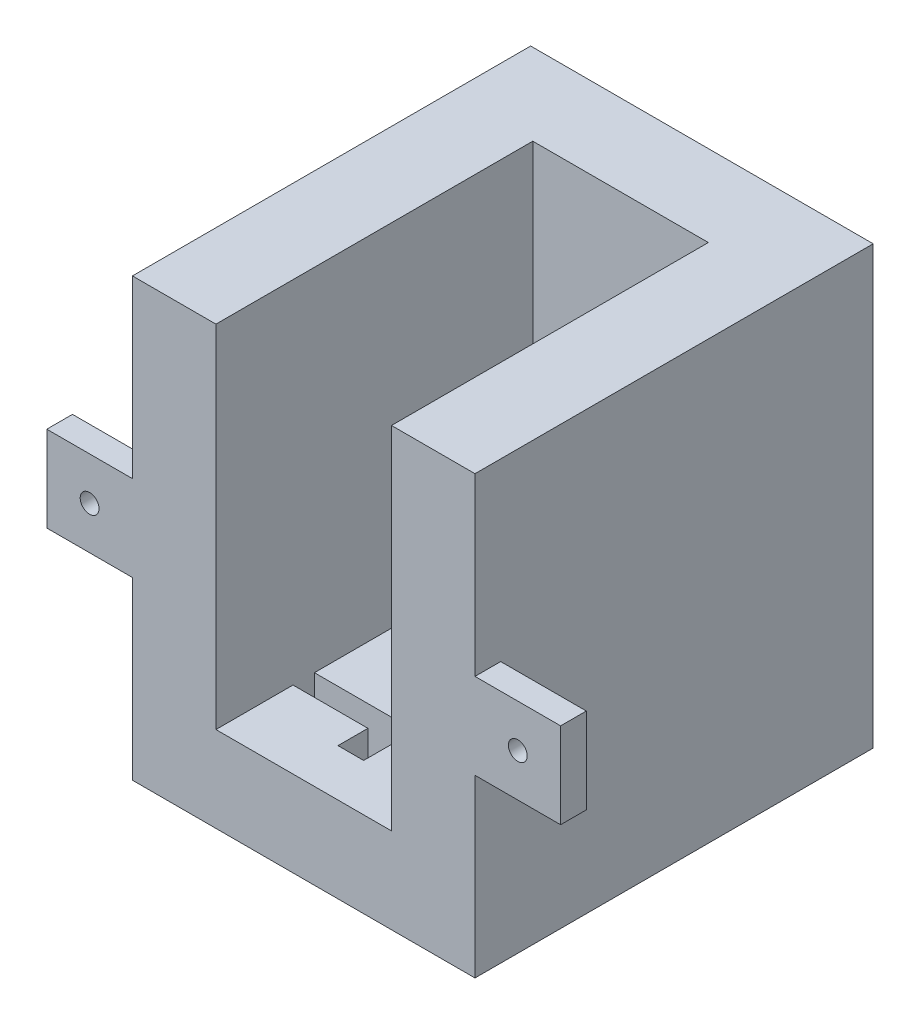
from build123d import *

# Parameters (mm, degrees)
SKETCH1_W           = 40
SKETCH1_H           = 46.5
BOSS_EXTRUDE1_DEPTH = 51
SKETCH2_W           = 20.5
SKETCH2_H           = 37
CUT_EXTRUDE1_DEPTH  = 41
CUT_EXTRUDE2_DEPTH  = 8.5
SKETCH4_W           = 3
SKETCH4_H           = 10
BOSS_EXTRUDE2_DEPTH = 10
SKETCH5_R           = 1.1
CUT_EXTRUDE3_DEPTH  = 10
SKETCH6_W           = 3
SKETCH6_H           = 10
BOSS_EXTRUDE3_DEPTH = 10
SKETCH7_R           = 1.1
CUT_EXTRUDE4_DEPTH  = 10


with BuildPart() as part:
    # Sketch1 → Boss-Extrude1 (new body)
    with BuildSketch(Plane(origin=(0, 0, 0), x_dir=(1, 0, 0), z_dir=(0, 1, 0))):
        Rectangle(SKETCH1_W, SKETCH1_H)
    extrude(amount=BOSS_EXTRUDE1_DEPTH)

    # Sketch2 → Cut-Extrude1 (cut)
    with BuildSketch(Plane(origin=(0, 51, 0), x_dir=(1, 0, 0), z_dir=(0, 1, 0))):
        with Locations((0, -4.75)):
            Rectangle(SKETCH2_W, SKETCH2_H)
    extrude(amount=-CUT_EXTRUDE1_DEPTH, mode=Mode.SUBTRACT)

    # Sketch3 → Cut-Extrude2 (cut)
    with BuildSketch(Plane(origin=(0, 10, 0), x_dir=(1, 0, 0), z_dir=(0, 1, 0))):
        Polygon((-10.25, -11.75), (10.25, -11.75), (10.25, -14.25), (1.5, -14.25), (1.5, -17.75), (-1.5, -17.75), (-1.5, -14.25), (-10.25, -14.25), align=None)
    extrude(amount=-CUT_EXTRUDE2_DEPTH, mode=Mode.SUBTRACT)

    # Sketch4 → Boss-Extrude2 (add)
    with BuildSketch(Plane(origin=(20, 0, 0), x_dir=(0, 0, -1), z_dir=(1, 0, 0))):
        with Locations((-21.75, 25.5)):
            Rectangle(SKETCH4_W, SKETCH4_H)
    extrude(amount=BOSS_EXTRUDE2_DEPTH)

    # Sketch5 → Cut-Extrude3 (cut)
    with BuildSketch(Plane(origin=(0, 0, 20.25), x_dir=(-1, 0, 0), z_dir=(0, 0, -1))):
        with Locations((-25, 25.5)):
            Circle(SKETCH5_R)
    extrude(amount=-CUT_EXTRUDE3_DEPTH, mode=Mode.SUBTRACT)

    # Sketch6 → Boss-Extrude3 (add)
    with BuildSketch(Plane.ZY.offset(20)):
        with Locations((21.75, 25.5)):
            Rectangle(SKETCH6_W, SKETCH6_H)
    extrude(amount=BOSS_EXTRUDE3_DEPTH)

    # Sketch7 → Cut-Extrude4 (cut)
    with BuildSketch(Plane(origin=(0, 0, 20.25), x_dir=(-1, 0, 0), z_dir=(0, 0, -1))):
        with Locations((25, 25.5)):
            Circle(SKETCH7_R)
    extrude(amount=-CUT_EXTRUDE4_DEPTH, mode=Mode.SUBTRACT)


solid = part.part
